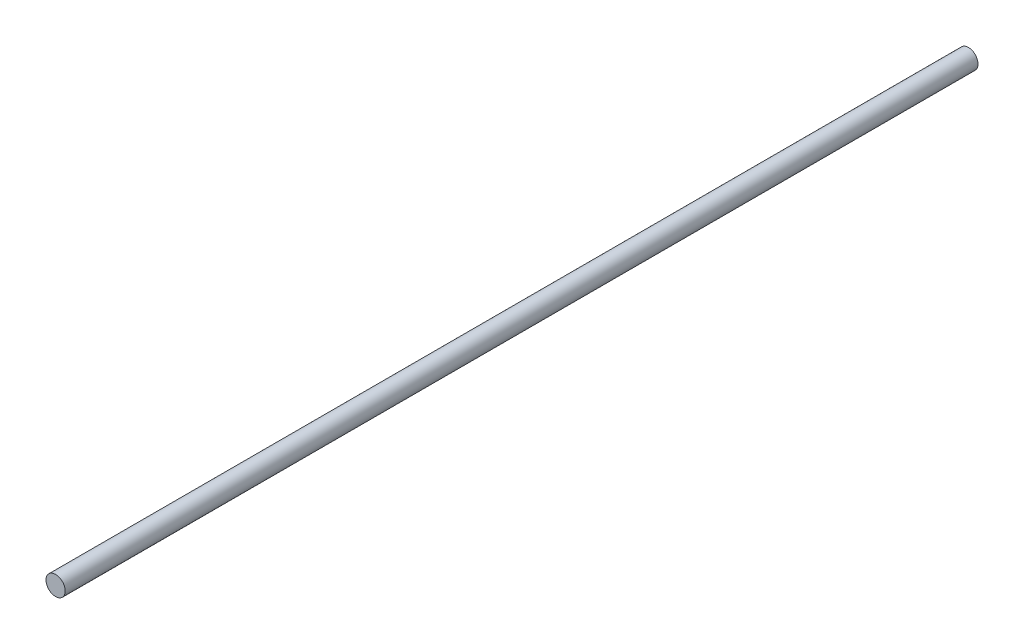
from build123d import *

# Parameters (mm, degrees)
SKETCH1_R           = 5
BOSS_EXTRUDE1_DEPTH = 475


with BuildPart() as part:
    # Sketch1 → Boss-Extrude1 (new body)
    with BuildSketch(Plane.XY):
        Circle(SKETCH1_R)
    extrude(amount=BOSS_EXTRUDE1_DEPTH)


solid = part.part
